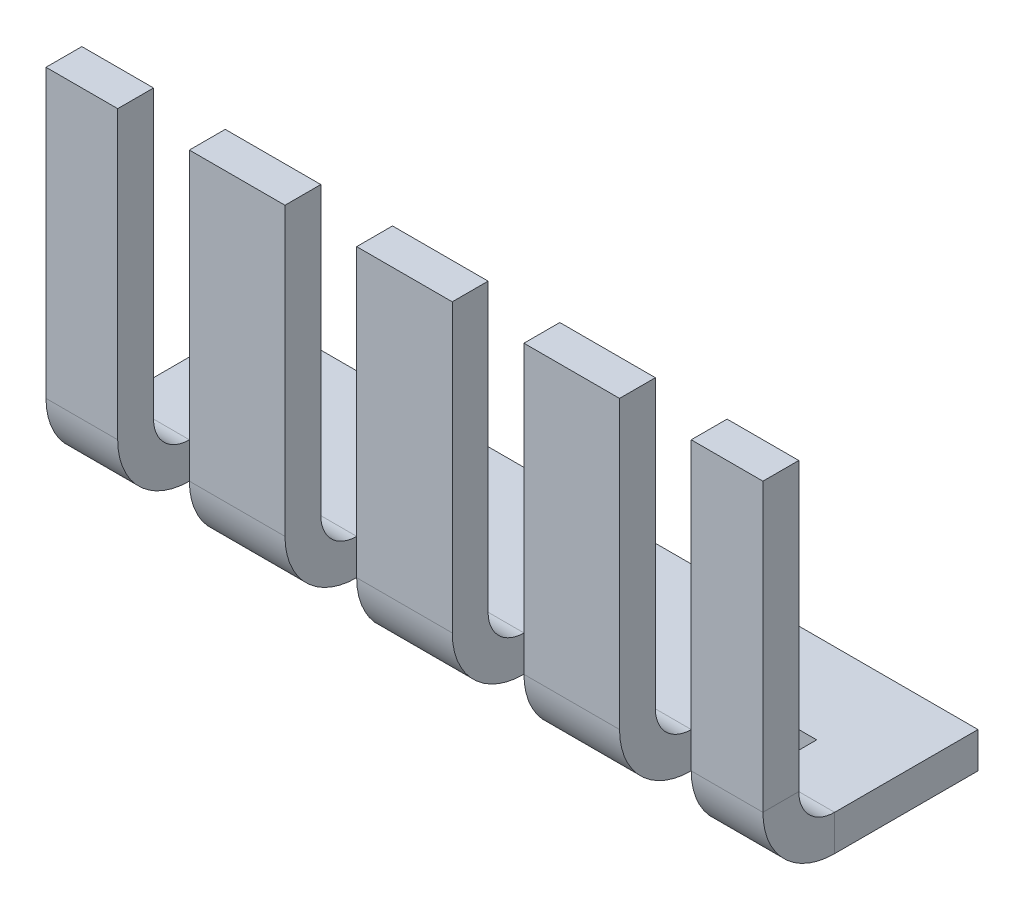
from build123d import *

# Parameters (mm, degrees)
VYSUNOUT_TENKOST_NN_1_DEPTH = 10
P_EV_ST_OBJEM1_START        = -10
P_EV_ST_OBJEM1_DEPTH        = 20
P_EV_ST_OBJEM1_2_DEPTH      = 20
SKICA10_W                   = 2
SKICA10_H                   = 10
ODEBRAT_VYSUNUT_M3_DEPTH    = 3.5


# Read off the part's stored shape, not the designer's step: Převést-Objem1
with BuildPart() as part:
    # Skica1 → Vysunout tenkostěnný1 (new, symmetric)
    with BuildSketch(Plane(origin=(0, 0, 0), x_dir=(0, 0, -1), z_dir=(1, 0, 0))):
        Polygon((-3.5, 10), (-3.5, 0), (2.5, 0), (2.5, 1), (-2.5, 1), (-2.5, 10), align=None)
    extrude(amount=VYSUNOUT_TENKOST_NN_1_DEPTH, both=True)

    # Převést-Objem1 outline → Převést-Objem1 (cut)
    with BuildSketch(Plane.YZ.offset(P_EV_ST_OBJEM1_START)):
        with BuildLine():
            Line((0, 3.5), (0, 1.5))
            ThreePointArc((0, 1.5), (0.585786438, 2.914213562), (2, 3.5))
            Line((2, 3.5), (0, 3.5))
        make_face()
    extrude(amount=P_EV_ST_OBJEM1_DEPTH, mode=Mode.SUBTRACT)

    # P_ev_st-Objem1 2 outline → P_ev_st-Objem1 2 (add)
    with BuildSketch(Plane.YZ.offset(P_EV_ST_OBJEM1_START)):
        with BuildLine():
            Line((1, 2.5), (1, 1.5))
            ThreePointArc((1, 1.5), (1.292893219, 2.207106781), (2, 2.5))
            Line((2, 2.5), (1, 2.5))
        make_face()
    extrude(amount=P_EV_ST_OBJEM1_2_DEPTH)

    # Skica10 → Odebrat vysunutím3 (cut)
    with BuildSketch(Plane.XY.offset(3.5)):
        with Locations((-7, 5)):
            Rectangle(SKICA10_W, SKICA10_H)
        with Locations((-2.333333333, 5)):
            Rectangle(SKICA10_W, SKICA10_H)
        with Locations((2.333333333, 5)):
            Rectangle(SKICA10_W, SKICA10_H)
        with Locations((7, 5)):
            Rectangle(SKICA10_W, SKICA10_H)
    extrude(amount=-ODEBRAT_VYSUNUT_M3_DEPTH, mode=Mode.SUBTRACT)


solid = part.part
